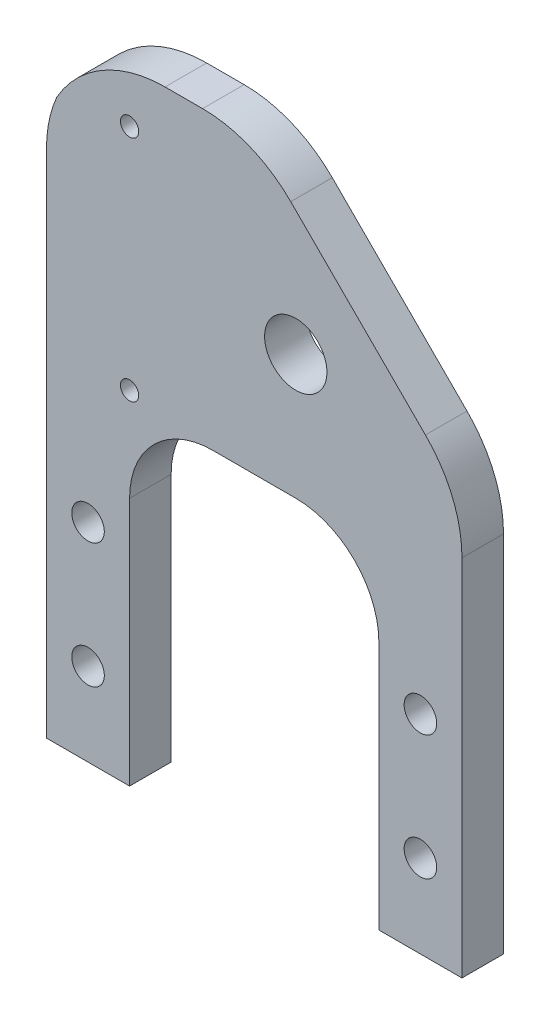
from build123d import *

# Parameters (mm, degrees)
BOSS_EXTRUDE1_DEPTH = 6.35
CUT_EXTRUDE1_REACH  = 116.652
SKETCH2_R           = 2.4892
CUT_EXTRUDE3_REACH  = 116.652
SKETCH4_R           = 1.397
SKETCH4_R_2         = 4.7625
FILLET4_R           = 12.7
FILLET5_R           = 19.05


with BuildPart() as part:
    # Sketch1 → Boss-Extrude1 (new body)
    with BuildSketch(Plane.XY):
        Polygon((0, 0), (12.7, 0), (12.7, 50.8), (50.8, 50.8), (50.8, 0), (63.5, 0), (63.5, 63.5), (31.75, 95.25), (6.35, 95.25), (0, 82.55), align=None)
    extrude(amount=BOSS_EXTRUDE1_DEPTH)

    # Sketch2 → Cut-Extrude1 (cut, up to next)
    with BuildSketch(Plane.XY.offset(6.35), mode=Mode.PRIVATE) as cut_extrude1_sk1:
        with Locations((6.35, 12.7)):
            Circle(SKETCH2_R)
    cut_extrude1_tool1 = extrude(cut_extrude1_sk1.sketch, amount=-CUT_EXTRUDE1_REACH, mode=Mode.PRIVATE) & part.part
    # Sketch2 → Cut-Extrude1 (cut, up to next)
    with BuildSketch(Plane.XY.offset(6.35), mode=Mode.PRIVATE) as cut_extrude1_sk2:
        with Locations((6.35, 31.75)):
            Circle(SKETCH2_R)
    cut_extrude1_tool2 = extrude(cut_extrude1_sk2.sketch, amount=-CUT_EXTRUDE1_REACH, mode=Mode.PRIVATE) & part.part
    # Sketch2 → Cut-Extrude1 (cut, up to next)
    with BuildSketch(Plane.XY.offset(6.35), mode=Mode.PRIVATE) as cut_extrude1_sk3:
        with Locations((57.15, 12.7)):
            Circle(SKETCH2_R)
    cut_extrude1_tool3 = extrude(cut_extrude1_sk3.sketch, amount=-CUT_EXTRUDE1_REACH, mode=Mode.PRIVATE) & part.part
    # Sketch2 → Cut-Extrude1 (cut, up to next)
    with BuildSketch(Plane.XY.offset(6.35), mode=Mode.PRIVATE) as cut_extrude1_sk4:
        with Locations((57.15, 31.75)):
            Circle(SKETCH2_R)
    cut_extrude1_tool4 = extrude(cut_extrude1_sk4.sketch, amount=-CUT_EXTRUDE1_REACH, mode=Mode.PRIVATE) & part.part
    add(cut_extrude1_tool1.solids().sort_by_distance((6.35, 12.7, 6.35))[0], mode=Mode.SUBTRACT)
    add(cut_extrude1_tool2.solids().sort_by_distance((6.35, 31.75, 6.35))[0], mode=Mode.SUBTRACT)
    add(cut_extrude1_tool3.solids().sort_by_distance((57.15, 12.7, 6.35))[0], mode=Mode.SUBTRACT)
    add(cut_extrude1_tool4.solids().sort_by_distance((57.15, 31.75, 6.35))[0], mode=Mode.SUBTRACT)

    # Sketch4 → Cut-Extrude3 (cut, up to next)
    with BuildSketch(Plane.XY.offset(6.35), mode=Mode.PRIVATE) as cut_extrude3_sk1:
        with Locations((12.7, 52.3875)):
            Circle(SKETCH4_R)
    cut_extrude3_tool1 = extrude(cut_extrude3_sk1.sketch, amount=-CUT_EXTRUDE3_REACH, mode=Mode.PRIVATE) & part.part
    # Sketch4 → Cut-Extrude3 (cut, up to next)
    with BuildSketch(Plane.XY.offset(6.35), mode=Mode.PRIVATE) as cut_extrude3_sk2:
        with Locations((12.7, 87.3125)):
            Circle(SKETCH4_R)
    cut_extrude3_tool2 = extrude(cut_extrude3_sk2.sketch, amount=-CUT_EXTRUDE3_REACH, mode=Mode.PRIVATE) & part.part
    # Sketch4 → Cut-Extrude3 (cut, up to next)
    with BuildSketch(Plane.XY.offset(6.35), mode=Mode.PRIVATE) as cut_extrude3_sk3:
        with Locations((38.1, 69.85)):
            Circle(SKETCH4_R_2)
    cut_extrude3_tool3 = extrude(cut_extrude3_sk3.sketch, amount=-CUT_EXTRUDE3_REACH, mode=Mode.PRIVATE) & part.part
    add(cut_extrude3_tool1.solids().sort_by_distance((12.7, 52.3875, 6.35))[0], mode=Mode.SUBTRACT)
    add(cut_extrude3_tool2.solids().sort_by_distance((12.7, 87.3125, 6.35))[0], mode=Mode.SUBTRACT)
    add(cut_extrude3_tool3.solids().sort_by_distance((38.1, 69.85, 6.35))[0], mode=Mode.SUBTRACT)

    # Fillet4
    fillet4_edges = [part.edges().sort_by_distance(p)[0] for p in [
        (50.8, 50.8, 3.175),
        (12.7, 50.8, 3.175),
    ]]
    fillet(fillet4_edges, radius=FILLET4_R)

    # Fillet5
    # the kernel refuses this fillet: 19.05 mm, written as the material it takes off along each edge
    with BuildSketch(Plane(origin=(0, 82.55, -11.242737428), x_dir=(0, -1, 0), z_dir=(0, 0, 1))) as fillet5_piece_1:
        with BuildLine():
            CenterArc((FILLET5_R * 0.2360679775, FILLET5_R), FILLET5_R, 243.434948823, 26.565051177)
            Line((-FILLET5_R * 0.211145618, FILLET5_R * 0.105572809), (0, 0))
            Line((0, 0), (FILLET5_R * 0.2360679775, 0))
        make_face()
    extrude(amount=28.835474857, mode=Mode.SUBTRACT)
    with BuildSketch(Plane(origin=(6.35, 95.25, -29.433868714), x_dir=(-0.4472135954999575, -0.8944271909999162, 0), z_dir=(0, 0, 1))) as fillet5_piece_2:
        with BuildLine():
            CenterArc((FILLET5_R * 0.61803398875, FILLET5_R), FILLET5_R, 206.565051177, 63.434948823)
            Line((-FILLET5_R * 0.27639320225, FILLET5_R * 0.5527864045), (0, 0))
            Line((0, 0), (FILLET5_R * 0.61803398875, 0))
        make_face()
    extrude(amount=65.217737428, mode=Mode.SUBTRACT)
    with BuildSketch(Plane(origin=(31.75, 95.25, -19.726920908), x_dir=(-1, 0, 0), z_dir=(0, 0, 1)), Plane(origin=(63.5, 63.5, -19.726920908), x_dir=(-0.7071067811865476, 0.7071067811865476, 0), z_dir=(0, 0, 1))) as fillet5_piece_3:
        with BuildLine():
            CenterArc((FILLET5_R * 0.414213562373, FILLET5_R), FILLET5_R, 225, 45)
            Line((-FILLET5_R * 0.292893218813, FILLET5_R * 0.292893218813), (0, 0))
            Line((0, 0), (FILLET5_R * 0.414213562373, 0))
        make_face()
    extrude(amount=45.803841816, mode=Mode.SUBTRACT)


solid = part.part
